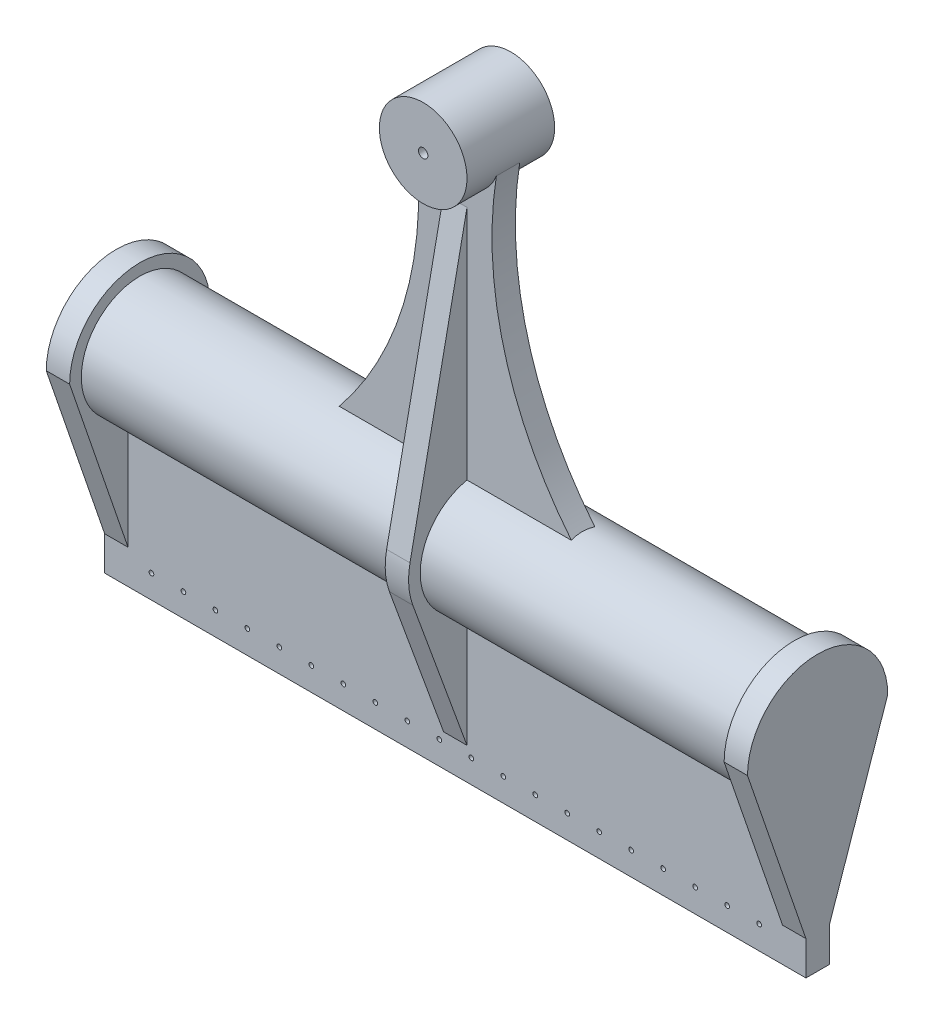
from build123d import *

# Parameters (mm, degrees)
BOSS_EXTRUDE1_DEPTH      = 2.54
BOSS_EXTRUDE1_DEPTH_BACK = 2.54
SKETCH1_W                = 44.45
SKETCH1_H                = 152.4
SKETCH1_R                = 0.508
BOSS_EXTRUDE2_DEPTH      = 76.2
BOSS_EXTRUDE2_DEPTH_BACK = 76.2
SKETCH2_R                = 12.7
BOSS_EXTRUDE3_START      = 71.12
BOSS_EXTRUDE3_DEPTH      = 5.08
BOSS_EXTRUDE4_START      = -76.2
BOSS_EXTRUDE4_DEPTH      = 5.08
BOSS_EXTRUDE5_DEPTH      = 2.54
BOSS_EXTRUDE5_DEPTH_BACK = 2.54
BOSS_EXTRUDE6_DEPTH      = 9.525
BOSS_EXTRUDE6_DEPTH_BACK = 9.525
SKETCH6_R                = 9.525
SKETCH6_R_2              = 1.016
BOSS_EXTRUDE7_DEPTH      = 2.54
BOSS_EXTRUDE7_DEPTH_BACK = 2.54


with BuildPart() as part:
    # Sketch1 → Boss-Extrude1 (new, two sides: drawn at the far end of the back side and taken through both)
    with BuildSketch(Plane(origin=(0, 0, 0), x_dir=(0, 1, 0), z_dir=(0, 0, 1)).offset(-BOSS_EXTRUDE1_DEPTH_BACK)):
        with Locations((-22.225, 0)):
            Rectangle(SKETCH1_W, SKETCH1_H)
        with Locations((-39.37, -66.04)):
            Circle(SKETCH1_R, mode=Mode.SUBTRACT)
        with Locations((-39.37, -59.088421053)):
            Circle(SKETCH1_R, mode=Mode.SUBTRACT)
        with Locations((-39.37, -52.136842105)):
            Circle(SKETCH1_R, mode=Mode.SUBTRACT)
        with Locations((-39.37, -45.185263158)):
            Circle(SKETCH1_R, mode=Mode.SUBTRACT)
        with Locations((-39.37, -38.233684211)):
            Circle(SKETCH1_R, mode=Mode.SUBTRACT)
        with Locations((-39.37, -31.282105263)):
            Circle(SKETCH1_R, mode=Mode.SUBTRACT)
        with Locations((-39.37, -24.330526316)):
            Circle(SKETCH1_R, mode=Mode.SUBTRACT)
        with Locations((-39.37, -17.378947368)):
            Circle(SKETCH1_R, mode=Mode.SUBTRACT)
        with Locations((-39.37, -10.427368421)):
            Circle(SKETCH1_R, mode=Mode.SUBTRACT)
        with Locations((-39.37, -3.475789474)):
            Circle(SKETCH1_R, mode=Mode.SUBTRACT)
        with Locations((-39.37, 3.475789474)):
            Circle(SKETCH1_R, mode=Mode.SUBTRACT)
        with Locations((-39.37, 10.427368421)):
            Circle(SKETCH1_R, mode=Mode.SUBTRACT)
        with Locations((-39.37, 17.378947368)):
            Circle(SKETCH1_R, mode=Mode.SUBTRACT)
        with Locations((-39.37, 24.330526316)):
            Circle(SKETCH1_R, mode=Mode.SUBTRACT)
        with Locations((-39.37, 31.282105263)):
            Circle(SKETCH1_R, mode=Mode.SUBTRACT)
        with Locations((-39.37, 38.233684211)):
            Circle(SKETCH1_R, mode=Mode.SUBTRACT)
        with Locations((-39.37, 45.185263158)):
            Circle(SKETCH1_R, mode=Mode.SUBTRACT)
        with Locations((-39.37, 52.136842105)):
            Circle(SKETCH1_R, mode=Mode.SUBTRACT)
        with Locations((-39.37, 59.088421053)):
            Circle(SKETCH1_R, mode=Mode.SUBTRACT)
        with Locations((-39.37, 66.04)):
            Circle(SKETCH1_R, mode=Mode.SUBTRACT)
    extrude(amount=BOSS_EXTRUDE1_DEPTH + BOSS_EXTRUDE1_DEPTH_BACK)

    # Sketch2 → Boss-Extrude2 (add, two sides: drawn at the far end of the back side and taken through both)
    with BuildSketch(Plane.YZ.offset(-BOSS_EXTRUDE2_DEPTH_BACK)):
        Circle(SKETCH2_R)
    extrude(amount=BOSS_EXTRUDE2_DEPTH + BOSS_EXTRUDE2_DEPTH_BACK)

    # Sketch3 → Boss-Extrude3 (add)
    with BuildSketch(Plane.YZ.offset(BOSS_EXTRUDE3_START)):
        with BuildLine():
            Line((0, 15.24), (-44.45, 0))
            Line((-44.45, 0), (0, -15.24))
            ThreePointArc((0, -15.24), (15.24, 0), (0, 15.24))
        make_face()
    extrude(amount=BOSS_EXTRUDE3_DEPTH)

    # Sketch4 → Boss-Extrude4 (add)
    with BuildSketch(Plane.YZ.offset(BOSS_EXTRUDE4_START)):
        with BuildLine():
            Line((0, 15.24), (-44.45, 0))
            Line((-44.45, 0), (0, -15.24))
            ThreePointArc((0, -15.24), (15.24, 0), (0, 15.24))
        make_face()
    extrude(amount=BOSS_EXTRUDE4_DEPTH)

    # Sketch5 → Boss-Extrude5 (add, two sides: drawn at the far end of the back side and taken through both)
    with BuildSketch(Plane(origin=(0, 0, 0), x_dir=(0, 1, 0), z_dir=(0, 0, 1)).offset(-BOSS_EXTRUDE5_DEPTH_BACK)):
        with BuildLine():
            Line((0, -38.1), (0, 38.1))
            ThreePointArc((0, 38.1), (33.985630195, 12.840847186), (76.2, 9.525))
            Line((76.2, 9.525), (76.2, -9.525))
            ThreePointArc((76.2, -9.525), (33.985630195, -12.840847186), (0, -38.1))
        make_face()
    extrude(amount=BOSS_EXTRUDE5_DEPTH + BOSS_EXTRUDE5_DEPTH_BACK)

    # Sketch6 → Boss-Extrude6 (add, two sides: drawn at the far end of the back side and taken through both)
    with BuildSketch(Plane(origin=(0, 0, 0), x_dir=(0, 1, 0), z_dir=(0, 0, 1)).offset(-BOSS_EXTRUDE6_DEPTH_BACK)):
        with Locations((76.2, 0)):
            Circle(SKETCH6_R)
        with Locations((76.2, 0)):
            Circle(SKETCH6_R_2, mode=Mode.SUBTRACT)
    extrude(amount=BOSS_EXTRUDE6_DEPTH + BOSS_EXTRUDE6_DEPTH_BACK)

    # Sketch7 → Boss-Extrude7 (add, two sides: drawn at the far end of the back side and taken through both)
    with BuildSketch(Plane.YZ.offset(-BOSS_EXTRUDE7_DEPTH_BACK)):
        with BuildLine():
            Line((-44.45, 0), (-5.225026376, 14.316255211))
            ThreePointArc((-5.225026376, 14.316255211), (-1.131177872, 15.197936065), (3.048089123, 14.93207128))
            Line((3.048089123, 14.93207128), (76.2, 0))
            Line((76.2, 0), (3.048089123, -14.93207128))
            ThreePointArc((3.048089123, -14.93207128), (-1.131177872, -15.197936065), (-5.225026376, -14.316255211))
            Line((-5.225026376, -14.316255211), (-44.45, 0))
        make_face()
    extrude(amount=BOSS_EXTRUDE7_DEPTH + BOSS_EXTRUDE7_DEPTH_BACK)


solid = part.part
